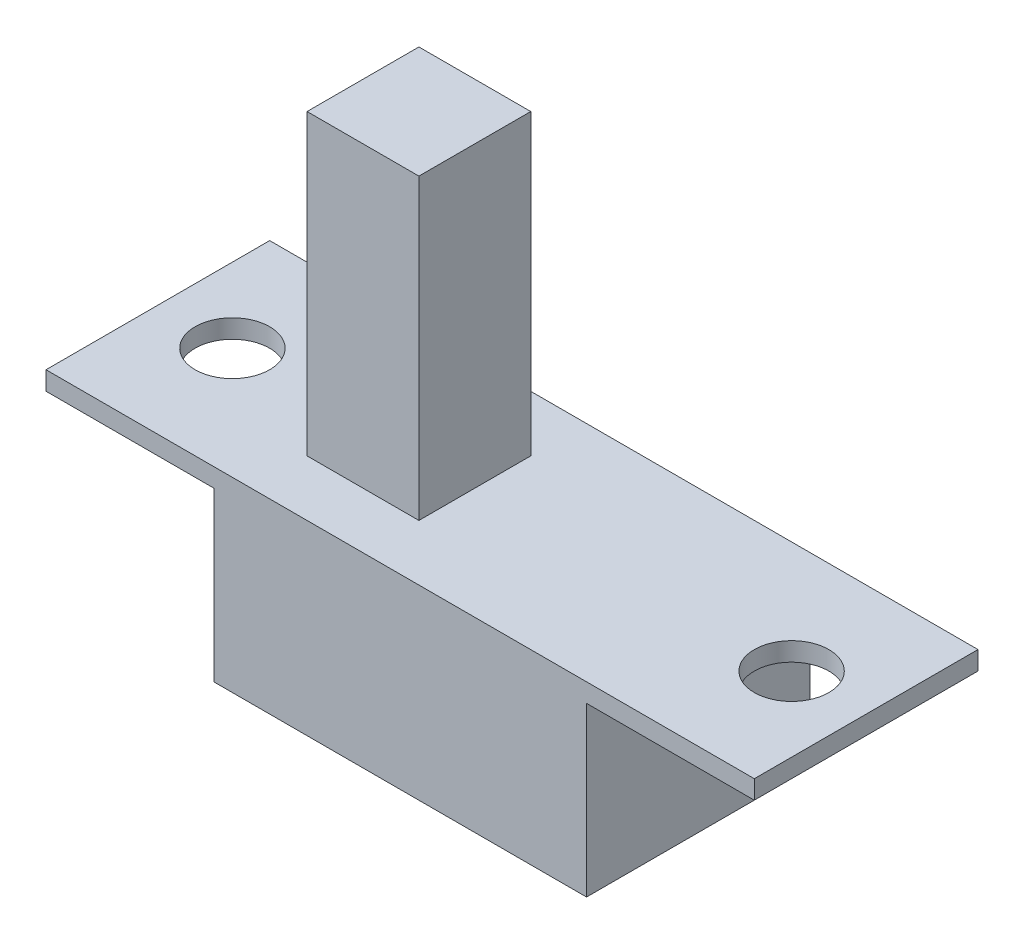
from build123d import *

# Parameters (mm, degrees)
SKETCH1_W           = 10
SKETCH1_H           = 6
BOSS_EXTRUDE1_DEPTH = 5
SKETCH2_W           = 19
SKETCH2_H           = 6
SKETCH2_R           = 1
BOSS_EXTRUDE2_DEPTH = 0.5
SKETCH3_W           = 3
SKETCH3_H           = 3
BOSS_EXTRUDE3_DEPTH = 8


with BuildPart() as part:
    # Sketch1 → Boss-Extrude1 (new body)
    with BuildSketch(Plane(origin=(0, 0, 0), x_dir=(1, 0, 0), z_dir=(0, 1, 0))):
        Rectangle(SKETCH1_W, SKETCH1_H)
    extrude(amount=BOSS_EXTRUDE1_DEPTH)

    # Sketch2 → Boss-Extrude2 (add)
    with BuildSketch(Plane(origin=(0, 5, 0), x_dir=(1, 0, 0), z_dir=(0, 1, 0))):
        Rectangle(SKETCH2_W, SKETCH2_H)
        with Locations((-7.5, 0)):
            Circle(SKETCH2_R, mode=Mode.SUBTRACT)
        with Locations((7.5, 0)):
            Circle(SKETCH2_R, mode=Mode.SUBTRACT)
    extrude(amount=-BOSS_EXTRUDE2_DEPTH)

    # Sketch3 → Boss-Extrude3 (add)
    with BuildSketch(Plane(origin=(0, 5, 0), x_dir=(1, 0, 0), z_dir=(0, 1, 0))):
        with Locations((-2.497009228, 0)):
            Rectangle(SKETCH3_W, SKETCH3_H)
    extrude(amount=BOSS_EXTRUDE3_DEPTH)


solid = part.part
